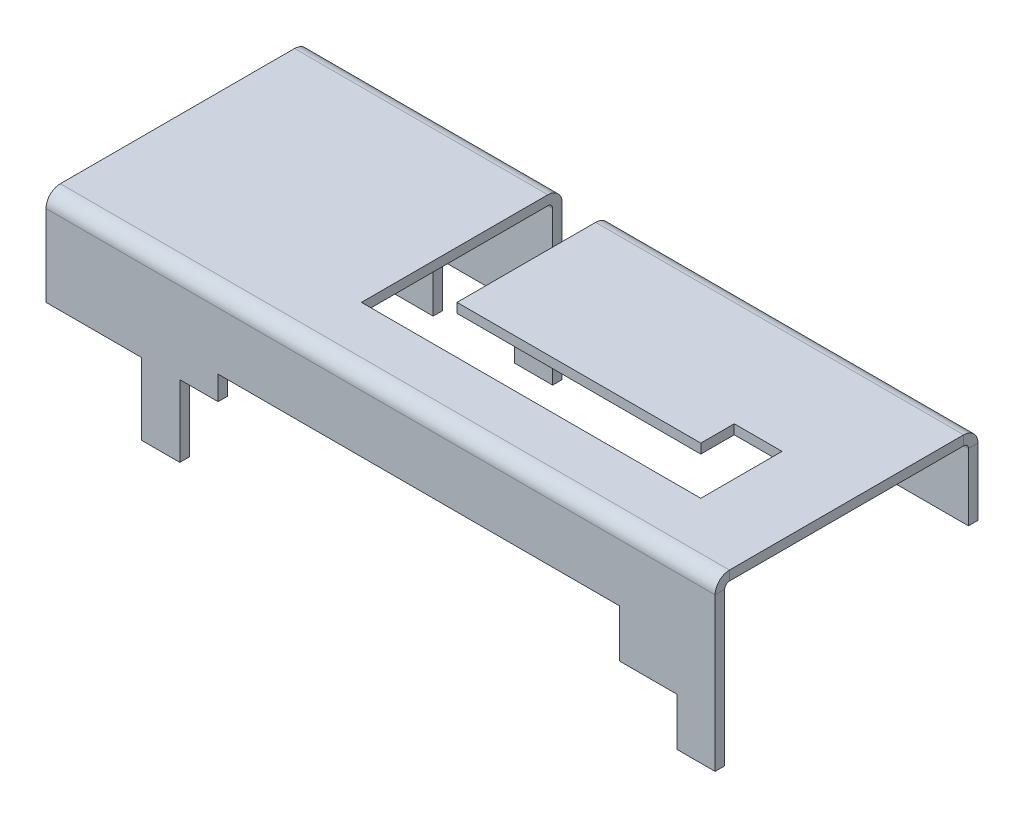
from build123d import *

# Parameters (mm, degrees)
SKETCH2_W              = 14
SKETCH2_H              = 5.5
BOSS_EXTRUDE1_DEPTH    = 0.1
SKETCH3_W              = 14
SKETCH3_H              = 3.5
BOSS_EXTRUDE2_DEPTH    = 0.2
CONVERT_SOLID1_START   = -7
CONVERT_SOLID1_DEPTH   = 14
CONVERT_SOLID1_2_DEPTH = 14
CUT_EXTRUDE1_REACH     = 11.529
SKETCH8_W              = 2
SKETCH8_H              = 1.5
CUT_EXTRUDE2_REACH     = 11.529
SKETCH9_W              = 8.7
SKETCH9_H              = 1.8
SKETCH9_W_2            = 1.7
SKETCH9_H_2            = 1.1
SKETCH9_W_3            = 2
CUT_EXTRUDE3_REACH     = 10.295


# Read off the part's stored shape, not the designer's step: Convert-Solid1
with BuildPart() as part:
    # Sketch2 → Boss-Extrude1 (new, symmetric)
    with BuildSketch(Plane(origin=(0, 0, 0), x_dir=(1, 0, 0), z_dir=(0, 1, 0))):
        Rectangle(SKETCH2_W, SKETCH2_H)
    extrude(amount=BOSS_EXTRUDE1_DEPTH, both=True)

    # Sketch3 → Boss-Extrude2 (add)
    with BuildSketch(Plane.XY.offset(2.75)):
        with Locations((0, -1.65)):
            Rectangle(SKETCH3_W, SKETCH3_H)
    boss_extrude2 = extrude(amount=-BOSS_EXTRUDE2_DEPTH)

    # Mirror1: Boss-Extrude2 across plane
    add(boss_extrude2.mirror(Plane.XY))

    # Convert-Solid1 outline → Convert-Solid1 (cut)
    with BuildSketch(Plane.YZ.offset(CONVERT_SOLID1_START)):
        with BuildLine():
            Line((0.1, 2.75), (-0.2, 2.75))
            ThreePointArc((-0.2, 2.75), (0.012132034, 2.662132034), (0.1, 2.45))
            Line((0.1, 2.45), (0.1, 2.75))
        make_face()
        with BuildLine():
            Line((0.1, -2.75), (0.1, -2.45))
            ThreePointArc((0.1, -2.45), (0.012132034, -2.662132034), (-0.2, -2.75))
            Line((-0.2, -2.75), (0.1, -2.75))
        make_face()
    extrude(amount=CONVERT_SOLID1_DEPTH, mode=Mode.SUBTRACT)

    # Convert-Solid1 2 outline → Convert-Solid1 2 (add)
    with BuildSketch(Plane.YZ.offset(CONVERT_SOLID1_START)):
        with BuildLine():
            Line((-0.1, 2.55), (-0.2, 2.55))
            ThreePointArc((-0.2, 2.55), (-0.129289322, 2.520710678), (-0.1, 2.45))
            Line((-0.1, 2.45), (-0.1, 2.55))
        make_face()
        with BuildLine():
            Line((-0.1, -2.55), (-0.1, -2.45))
            ThreePointArc((-0.1, -2.45), (-0.129289322, -2.520710678), (-0.2, -2.55))
            Line((-0.2, -2.55), (-0.1, -2.55))
        make_face()
    extrude(amount=CONVERT_SOLID1_2_DEPTH)

    # Sketch8 → Cut-Extrude1 (cut, up to next)
    with BuildSketch(Plane.XY.offset(2.75), mode=Mode.PRIVATE) as cut_extrude1_sk1:
        Polygon((-4.2, -3.4), (-4.2, -1.9), (-3.4, -1.9), (-3.4, -1.4), (5, -1.4), (5, -2.4), (6.2, -2.4), (6.2, -3.4), align=None)
    cut_extrude1_tool1 = extrude(cut_extrude1_sk1.sketch, amount=-CUT_EXTRUDE1_REACH, mode=Mode.PRIVATE) & part.part
    # Sketch8 → Cut-Extrude1 (cut, up to next)
    with BuildSketch(Plane.XY.offset(2.75), mode=Mode.PRIVATE) as cut_extrude1_sk2:
        with Locations((-6, -2.65)):
            Rectangle(SKETCH8_W, SKETCH8_H)
    cut_extrude1_tool2 = extrude(cut_extrude1_sk2.sketch, amount=-CUT_EXTRUDE1_REACH, mode=Mode.PRIVATE) & part.part
    add(cut_extrude1_tool1.solids().sort_by_distance((0.8125, -2.446875, 2.75))[0], mode=Mode.SUBTRACT)
    add(cut_extrude1_tool2.solids().sort_by_distance((-6, -2.65, 2.75))[0], mode=Mode.SUBTRACT)

    # Sketch9 → Cut-Extrude2 (cut, up to next)
    with BuildSketch(Plane(origin=(0, 0, -2.75), x_dir=(-1, 0, 0), z_dir=(0, 0, -1)), mode=Mode.PRIVATE) as cut_extrude2_sk1:
        with Locations((-2.65, -2.5)):
            Rectangle(SKETCH9_W, SKETCH9_H)
    cut_extrude2_tool1 = extrude(cut_extrude2_sk1.sketch, amount=-CUT_EXTRUDE2_REACH, mode=Mode.PRIVATE) & part.part
    # Sketch9 → Cut-Extrude2 (cut, up to next)
    with BuildSketch(Plane(origin=(0, 0, -2.75), x_dir=(-1, 0, 0), z_dir=(0, 0, -1)), mode=Mode.PRIVATE) as cut_extrude2_sk2:
        with Locations((3.35, -2.85)):
            Rectangle(SKETCH9_W_2, SKETCH9_H_2)
    cut_extrude2_tool2 = extrude(cut_extrude2_sk2.sketch, amount=-CUT_EXTRUDE2_REACH, mode=Mode.PRIVATE) & part.part
    # Sketch9 → Cut-Extrude2 (cut, up to next)
    with BuildSketch(Plane(origin=(0, 0, -2.75), x_dir=(-1, 0, 0), z_dir=(0, 0, -1)), mode=Mode.PRIVATE) as cut_extrude2_sk3:
        with Locations((6, -2.85)):
            Rectangle(SKETCH9_W_3, SKETCH9_H_2)
    cut_extrude2_tool3 = extrude(cut_extrude2_sk3.sketch, amount=-CUT_EXTRUDE2_REACH, mode=Mode.PRIVATE) & part.part
    add(cut_extrude2_tool1.solids().sort_by_distance((2.65, -2.5, -2.75))[0], mode=Mode.SUBTRACT)
    add(cut_extrude2_tool2.solids().sort_by_distance((-3.35, -2.85, -2.75))[0], mode=Mode.SUBTRACT)
    add(cut_extrude2_tool3.solids().sort_by_distance((-6, -2.85, -2.75))[0], mode=Mode.SUBTRACT)

    # Sketch10 → Cut-Extrude3 (cut, up to next)
    with BuildSketch(Plane(origin=(0, 0.1, 0), x_dir=(1, 0, 0), z_dir=(0, 1, 0)), mode=Mode.PRIVATE) as cut_extrude3_sk1:
        Polygon((-1.7, -1.45), (5.4, -1.45), (5.4, 0.25), (4.4, 0.25), (4.4, -0.45), (-0.7, -0.45), (-0.7, 2.75), (-1.7, 2.75), align=None)
    cut_extrude3_tool1 = extrude(cut_extrude3_sk1.sketch, amount=-CUT_EXTRUDE3_REACH, mode=Mode.PRIVATE) & part.part
    add(cut_extrude3_tool1.solids().sort_by_distance((1.85, 0.1, 1.367508))[0], mode=Mode.SUBTRACT)


solid = part.part
